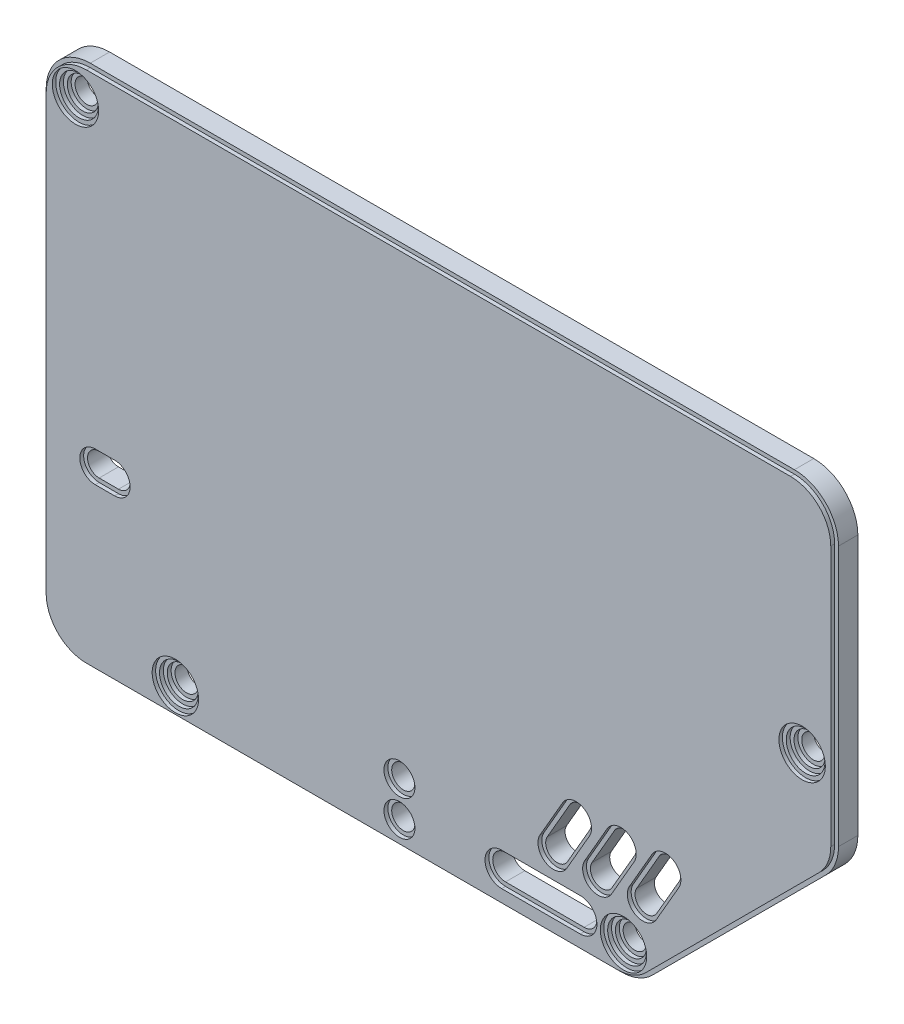
from build123d import *

# Parameters (mm, degrees)
BOSS_EXTRUDE1_DEPTH = 3
CUT_EXTRUDE1_DEPTH  = 121.966441627
SKETCH8_R           = 1
CUT_EXTRUDE2_DEPTH  = 10
SKETCH10_R          = 1
CUT_EXTRUDE4_DEPTH  = 10
SKETCH12_R          = 1.5
CUT_EXTRUDE5_DEPTH  = 10
SKETCH13_R          = 2
SKETCH13_R_2        = 1.5
CUT_EXTRUDE6_DEPTH  = 0.5


with BuildPart() as part:
    # Sketch2 → Boss-Extrude1 (new body)
    with BuildSketch(Plane.XY.offset(8.62)):
        with BuildLine():
            Line((4.5, 66.2), (95.5, 66.2))
            ThreePointArc((95.5, 66.2), (99.530508653, 64.530508653), (101.2, 60.5))
            Line((101.2, 60.5), (101.2, 26.863961031))
            ThreePointArc((101.2, 26.863961031), (100.766113335, 24.682665466), (99.530508653, 22.833452378))
            Line((99.530508653, 22.833452378), (77.166547622, 0.469491347))
            ThreePointArc((77.166547622, 0.469491347), (75.317334534, -0.766113335), (73.136038969, -1.2))
            Line((73.136038969, -1.2), (4.5, -1.2))
            ThreePointArc((4.5, -1.2), (0.469491347, 0.469491347), (-1.2, 4.5))
            Line((-1.2, 4.5), (-1.2, 60.5))
            ThreePointArc((-1.2, 60.5), (0.469491347, 64.530508653), (4.5, 66.2))
        make_face()
    extrude(amount=BOSS_EXTRUDE1_DEPTH)

    # Sketch6 → Cut-Extrude1 (cut, through all)
    with BuildSketch(Plane.XY.offset(11.62)):
        with BuildLine():
            Line((68.326, 1.397), (58.166, 1.397))
            ThreePointArc((58.166, 1.397), (56.515, 3.048), (58.166, 4.699))
            Line((58.166, 4.699), (68.326, 4.699))
            ThreePointArc((68.326, 4.699), (69.977, 3.048), (68.326, 1.397))
        make_face()
    extrude(amount=-CUT_EXTRUDE1_DEPTH, mode=Mode.SUBTRACT)

    # Sketch8 → Cut-Extrude2 (cut)
    with BuildSketch(Plane.XY.offset(11.62)):
        with Locations((44.958, 2.539999994)):
            Circle(SKETCH8_R)
        with Locations((44.958000001, 6.095999994)):
            Circle(SKETCH8_R)
    extrude(amount=-CUT_EXTRUDE2_DEPTH, mode=Mode.SUBTRACT)

    # Sketch10 → Cut-Extrude4 (cut)
    with BuildSketch(Plane.XY.offset(11.62)):
        with Locations((5.147878003, 21.843999999)):
            Circle(SKETCH10_R)
        with Locations((8.647878003, 21.843999999)):
            Circle(SKETCH10_R)
    extrude(amount=-CUT_EXTRUDE4_DEPTH, mode=Mode.SUBTRACT)

    # Sketch12 → Cut-Extrude5 (cut)
    with BuildSketch(Plane.XY.offset(11.62)):
        with Locations((44.958000001, 6.595999994)):
            Circle(SKETCH12_R)
        with Locations((44.958000001, 2.039999994)):
            Circle(SKETCH12_R)
        with BuildLine():
            Line((5.647878003, 23.343999999), (8.147878003, 23.343999999))
            ThreePointArc((8.147878003, 23.343999999), (9.647878003, 21.843999999), (8.147878003, 20.343999999))
            Line((8.147878003, 20.343999999), (5.647878003, 20.343999999))
            ThreePointArc((5.647878003, 20.343999999), (4.147878003, 21.843999999), (5.647878003, 23.343999999))
        make_face()
        with BuildLine():
            Line((69.33347303, 9.140911087), (72.256122761, 14.203088914))
            ThreePointArc((72.256122761, 14.203088914), (74.305160867, 14.752127019), (74.854198973, 12.703088914))
            Line((74.854198973, 12.703088914), (71.931549242, 7.640911087))
            ThreePointArc((71.931549242, 7.640911087), (69.882511136, 7.091872982), (69.33347303, 9.140911087))
        make_face()
        with BuildLine():
            Line((63.559970339, 9.140911087), (66.482620069, 14.203088914))
            ThreePointArc((66.482620069, 14.203088914), (68.531658175, 14.752127019), (69.080696281, 12.703088914))
            Line((69.080696281, 12.703088914), (66.15804655, 7.640911087))
            ThreePointArc((66.15804655, 7.640911087), (64.109008444, 7.091872982), (63.559970339, 9.140911087))
        make_face()
        with BuildLine():
            Line((75.106975722, 9.140911087), (78.029625453, 14.203088914))
            ThreePointArc((78.029625453, 14.203088914), (80.078663559, 14.752127019), (80.627701665, 12.703088914))
            Line((80.627701665, 12.703088914), (77.705051934, 7.640911087))
            ThreePointArc((77.705051934, 7.640911087), (75.656013828, 7.091872982), (75.106975722, 9.140911087))
        make_face()
    extrude(amount=-CUT_EXTRUDE5_DEPTH, mode=Mode.SUBTRACT)

    # Sketch13 → Cut-Extrude6 (cut)
    # profile 1 of 8: a face of its own
    with BuildSketch(Plane.XY.offset(11.62)):
        with BuildLine():
            Line((-1.2, 60.5), (-1.2, 4.5))
            ThreePointArc((-1.2, 4.5), (0.469491347, 0.469491347), (4.5, -1.2))
            Line((4.5, -1.2), (73.136038969, -1.2))
            ThreePointArc((73.136038969, -1.2), (75.317334534, -0.766113335), (77.166547622, 0.469491347))
            Line((77.166547622, 0.469491347), (99.530508653, 22.833452378))
            ThreePointArc((99.530508653, 22.833452378), (100.766113335, 24.682665466), (101.2, 26.863961031))
            Line((101.2, 26.863961031), (101.2, 60.5))
            ThreePointArc((101.2, 60.5), (99.530508653, 64.530508653), (95.5, 66.2))
            Line((95.5, 66.2), (4.5, 66.2))
            ThreePointArc((4.5, 66.2), (0.469491347, 64.530508653), (-1.2, 60.5))
        make_face()
        with BuildLine():
            Line((4.5, 65.7), (95.5, 65.7))
            ThreePointArc((95.5, 65.7), (99.176955262, 64.176955262), (100.7, 60.5))
            Line((100.7, 60.5), (100.7, 26.863961031))
            ThreePointArc((100.7, 26.863961031), (100.304173569, 24.874007182), (99.176955262, 23.187005769))
            Line((99.176955262, 23.187005769), (76.812994231, 0.823044738))
            ThreePointArc((76.812994231, 0.823044738), (75.125992818, -0.304173569), (73.136038969, -0.7))
            Line((73.136038969, -0.7), (4.5, -0.7))
            ThreePointArc((4.5, -0.7), (0.823044738, 0.823044738), (-0.7, 4.5))
            Line((-0.7, 4.5), (-0.7, 60.5))
            ThreePointArc((-0.7, 60.5), (0.823044738, 64.176955262), (4.5, 65.7))
        make_face(mode=Mode.SUBTRACT)
    # profile 2 of 8: a face of its own
    with BuildSketch(Plane.XY.offset(11.62)):
        with Locations((44.958000001, 2.039999994)):
            Circle(SKETCH13_R)
        with Locations((44.958000001, 2.039999994)):
            Circle(SKETCH13_R_2, mode=Mode.SUBTRACT)
    # profile 3 of 8: a face of its own
    with BuildSketch(Plane.XY.offset(11.62)):
        with Locations((44.958000001, 6.595999994)):
            Circle(SKETCH13_R)
        with Locations((44.958000001, 6.595999994)):
            Circle(SKETCH13_R_2, mode=Mode.SUBTRACT)
    # profile 4 of 8: a face of its own
    with BuildSketch(Plane.XY.offset(11.62)):
        with BuildLine():
            ThreePointArc((74.67396302, 9.390911087), (75.406013828, 6.65886028), (78.138064636, 7.390911087))
            Line((78.138064636, 7.390911087), (81.060714366, 12.453088914))
            ThreePointArc((81.060714366, 12.453088914), (80.328663559, 15.185139721), (77.596612751, 14.453088914))
            Line((77.596612751, 14.453088914), (74.67396302, 9.390911087))
        make_face()
        with BuildLine():
            ThreePointArc((78.029625453, 14.203088914), (80.078663559, 14.752127019), (80.627701665, 12.703088914))
            Line((80.627701665, 12.703088914), (77.705051934, 7.640911087))
            ThreePointArc((77.705051934, 7.640911087), (75.656013828, 7.091872982), (75.106975722, 9.140911087))
            Line((75.106975722, 9.140911087), (78.029625453, 14.203088914))
        make_face(mode=Mode.SUBTRACT)
    # profile 5 of 8: a face of its own
    with BuildSketch(Plane.XY.offset(11.62)):
        with BuildLine():
            ThreePointArc((68.900460329, 9.390911087), (69.632511136, 6.65886028), (72.364561944, 7.390911087))
            Line((72.364561944, 7.390911087), (75.287211675, 12.453088914))
            ThreePointArc((75.287211675, 12.453088914), (74.555160867, 15.185139721), (71.823110059, 14.453088914))
            Line((71.823110059, 14.453088914), (68.900460329, 9.390911087))
        make_face()
        with BuildLine():
            ThreePointArc((72.256122761, 14.203088914), (74.305160867, 14.752127019), (74.854198973, 12.703088914))
            Line((74.854198973, 12.703088914), (71.931549242, 7.640911087))
            ThreePointArc((71.931549242, 7.640911087), (69.882511136, 7.091872982), (69.33347303, 9.140911087))
            Line((69.33347303, 9.140911087), (72.256122761, 14.203088914))
        make_face(mode=Mode.SUBTRACT)
    # profile 6 of 8: a face of its own
    with BuildSketch(Plane.XY.offset(11.62)):
        with BuildLine():
            ThreePointArc((63.126957637, 9.390911087), (63.859008444, 6.65886028), (66.591059252, 7.390911087))
            Line((66.591059252, 7.390911087), (69.513708983, 12.453088914))
            ThreePointArc((69.513708983, 12.453088914), (68.781658175, 15.185139721), (66.049607368, 14.453088914))
            Line((66.049607368, 14.453088914), (63.126957637, 9.390911087))
        make_face()
        with BuildLine():
            ThreePointArc((66.482620069, 14.203088914), (68.531658175, 14.752127019), (69.080696281, 12.703088914))
            Line((69.080696281, 12.703088914), (66.15804655, 7.640911087))
            ThreePointArc((66.15804655, 7.640911087), (64.109008444, 7.091872982), (63.559970339, 9.140911087))
            Line((63.559970339, 9.140911087), (66.482620069, 14.203088914))
        make_face(mode=Mode.SUBTRACT)
    # profile 7 of 8: a face of its own
    with BuildSketch(Plane.XY.offset(11.62)):
        with BuildLine():
            ThreePointArc((58.166, 5.199), (56.015, 3.048), (58.166, 0.897))
            Line((58.166, 0.897), (68.326, 0.897))
            ThreePointArc((68.326, 0.897), (70.477, 3.048), (68.326, 5.199))
            Line((68.326, 5.199), (58.166, 5.199))
        make_face()
        with BuildLine():
            ThreePointArc((58.166, 1.397), (56.515, 3.048), (58.166, 4.699))
            Line((58.166, 4.699), (68.326, 4.699))
            ThreePointArc((68.326, 4.699), (69.977, 3.048), (68.326, 1.397))
            Line((68.326, 1.397), (58.166, 1.397))
        make_face(mode=Mode.SUBTRACT)
    # profile 8 of 8: a face of its own
    with BuildSketch(Plane.XY.offset(11.62)):
        with BuildLine():
            ThreePointArc((5.647878003, 23.843999999), (3.647878003, 21.843999999), (5.647878003, 19.843999999))
            Line((5.647878003, 19.843999999), (8.147878003, 19.843999999))
            ThreePointArc((8.147878003, 19.843999999), (10.147878003, 21.843999999), (8.147878003, 23.843999999))
            Line((8.147878003, 23.843999999), (5.647878003, 23.843999999))
        make_face()
        with BuildLine():
            ThreePointArc((8.147878003, 23.343999999), (9.647878003, 21.843999999), (8.147878003, 20.343999999))
            Line((8.147878003, 20.343999999), (5.647878003, 20.343999999))
            ThreePointArc((5.647878003, 20.343999999), (4.147878003, 21.843999999), (5.647878003, 23.343999999))
            Line((5.647878003, 23.343999999), (8.147878003, 23.343999999))
        make_face(mode=Mode.SUBTRACT)
    extrude(amount=-CUT_EXTRUDE6_DEPTH, mode=Mode.SUBTRACT)

    # Sketch14 → Cut-Revolve1 (revolve, cut)
    with BuildSketch(Plane(origin=(0, 2.5, 0), x_dir=(-1, 0, 0), z_dir=(0, -1, 0))):
        Polygon((-16, -11.62), (-16, -8.62), (-17.5, -8.62), (-17.5, -9.92), (-17.5, -10.17), (-18, -10.17), (-18, -10.67), (-18.5, -10.67), (-18.5, -11.17), (-19, -11.17), (-19, -11.42), (-19, -11.62), align=None)
    cut_revolve1 = revolve(axis=Axis((16, 2.5, 11.62), (0, 0, -1)), mode=Mode.SUBTRACT)

    # Sketch-Pattern1: Cut-Revolve1 at 3 more places
    with Locations((-12.914214, 59.414214, 0), (57.917501, 0.15899, 0), (81, 33, 0)):
        add(cut_revolve1, mode=Mode.SUBTRACT)


solid = part.part
